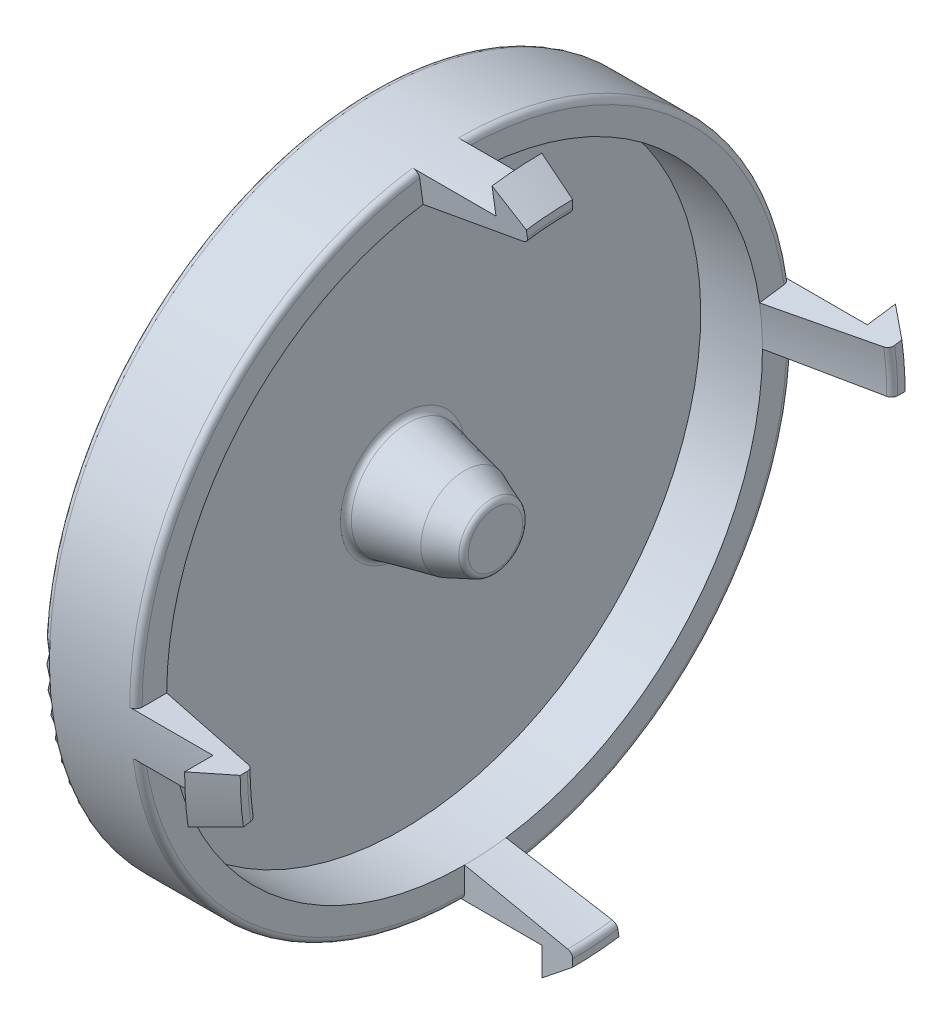
from build123d import *

# Parameters (mm, degrees)
REVOLVE6_ANGLE    = 8
CIRPATTERN2_COUNT = 4
FILLET2_R         = 0.1


with BuildPart() as part:
    # Sketch1 → Revolve2 (revolve)
    with BuildSketch(Plane.XY):
        Polygon((1, 5.325), (0, 5.325), (-0.5, 5.325), (-0.5, 4.885), (-0.5, 1.49), (-0.5, 0), (0.25, 0), (1, 0), (1.5, 0), (1.5, 0.507702176), (1, 0.71), (0, 0.93), (0, 4.825), (1, 4.825), align=None)
    revolve(axis=Axis((1, 0, 0), (-1, 0, 0)))

    # Sketch4 → Revolve6 (revolve)
    with BuildSketch(Plane.XY):
        Polygon((2.75, 5.185), (2.75, 5.385), (2.25, 5.785), (2.25, 5.325), (1, 5.325), (1, 5.185), (1, 4.825), align=None)
    revolve6 = revolve(axis=Axis((0, 0, 0), (1, 0, 0)), revolution_arc=REVOLVE6_ANGLE)

    # CirPattern2: Revolve6 ×4 about axis
    cirpattern2_axis = Axis((0, 0, 0), (-1, 0, 0))
    for i in range(1, CIRPATTERN2_COUNT):
        add(revolve6.rotate(cirpattern2_axis, i * 360 / CIRPATTERN2_COUNT))

    # Fillet2
    # the kernel refuses this fillet: 0.1 mm, written as the material it adds along each edge
    with BuildSketch(Plane(origin=(0, 0, 0), x_dir=(0, 1, 0), z_dir=(0, 0, 1))) as fillet2_piece_1:
        with BuildLine():
            CenterArc((0.93 + FILLET2_R * 0.803914058894, -FILLET2_R), FILLET2_R, 90, 77.592581473)
            Line((0.93 - FILLET2_R * 0.172730407811, -FILLET2_R * 0.785138217325), (0.93, 0))
            Line((0.93, 0), (0.93 + FILLET2_R * 0.803914058894, 0))
        make_face()
    revolve(axis=Axis((0, 0, 0), (-1, 0, 0)))
    # the kernel refuses this fillet: 0.1 mm, written as the material it takes off along each edge
    with BuildSketch(Plane(origin=(1.5, 0, 0), x_dir=(0, 1, 0), z_dir=(0, 0, 1))) as fillet2_2_piece_1:
        with BuildLine():
            CenterArc((0.507702176 - FILLET2_R * 0.674152532906, FILLET2_R), FILLET2_R, 270, 67.971958378)
            Line((0.507702176 - FILLET2_R * 0.674152532906, 0), (0.507702176, 0))
            Line((0.507702176, 0), (0.507702176 + FILLET2_R * 0.252847871179, FILLET2_R * 0.62493967042))
        make_face()
    revolve(axis=Axis((1.5, 0, 0), (-1, 0, 0)), mode=Mode.SUBTRACT)
    with BuildSketch(Plane(origin=(1, 0, 0), x_dir=(0, 1, 0), z_dir=(0, 0, 1))) as fillet2_2_piece_2:
        with BuildLine():
            CenterArc((5.325 - FILLET2_R, FILLET2_R), FILLET2_R, 270, 90)
            Line((5.325, FILLET2_R), (5.325, 0))
            Line((5.325, 0), (5.325 - FILLET2_R, 0))
        make_face()
    revolve(axis=Axis((1, 0, 0), (-1, 0, 0)), revolution_arc=82, mode=Mode.SUBTRACT)
    with BuildSketch(Plane(origin=(2.75, 0, 0), x_dir=(0, -0.03929693023506649, -0.9992275773186509), z_dir=(0, -0.9992275773186509, 0.03929693023506649))) as fillet2_2_piece_3:
        with BuildLine():
            CenterArc((5.185 + FILLET2_R * 0.815225657351, -FILLET2_R), FILLET2_R, 90, 78.375604276)
            Line((5.185 + FILLET2_R * 0.815225657351, 0), (5.185, 0))
            Line((5.185, 0), (5.185 - FILLET2_R * 0.164263887349, -FILLET2_R * 0.798505007947))
        make_face()
    revolve(axis=Axis((2.75, 0, 0), (1, 0, 0)), revolution_arc=12.50425629, mode=Mode.SUBTRACT)
    with BuildSketch(Plane(origin=(1, 0, 0), x_dir=(0, 0, -1), z_dir=(0, 1, 0))) as fillet2_2_piece_4:
        with BuildLine():
            CenterArc((5.325 - FILLET2_R, FILLET2_R), FILLET2_R, 270, 90)
            Line((5.325, FILLET2_R), (5.325, 0))
            Line((5.325, 0), (5.325 - FILLET2_R, 0))
        make_face()
    revolve(axis=Axis((1, 0, 0), (-1, 0, 0)), revolution_arc=82, mode=Mode.SUBTRACT)
    with BuildSketch(Plane(origin=(2.75, 0, 0), x_dir=(0, -0.9992275773186509, 0.039296930235066474), z_dir=(0, 0.039296930235066474, 0.9992275773186509))) as fillet2_2_piece_5:
        with BuildLine():
            CenterArc((5.185 + FILLET2_R * 0.815225657351, -FILLET2_R), FILLET2_R, 90, 78.375604276)
            Line((5.185 + FILLET2_R * 0.815225657351, 0), (5.185, 0))
            Line((5.185, 0), (5.185 - FILLET2_R * 0.164263887349, -FILLET2_R * 0.798505007947))
        make_face()
    revolve(axis=Axis((2.75, 0, 0), (1, 0, 0)), revolution_arc=12.50425629, mode=Mode.SUBTRACT)
    with BuildSketch(Plane(origin=(1, 0, 0), x_dir=(0, -1, 0), z_dir=(0, 0, -1))) as fillet2_2_piece_6:
        with BuildLine():
            CenterArc((5.325 - FILLET2_R, FILLET2_R), FILLET2_R, 270, 90)
            Line((5.325, FILLET2_R), (5.325, 0))
            Line((5.325, 0), (5.325 - FILLET2_R, 0))
        make_face()
    revolve(axis=Axis((1, 0, 0), (-1, 0, 0)), revolution_arc=82, mode=Mode.SUBTRACT)
    with BuildSketch(Plane(origin=(2.75, 0, 0), x_dir=(0, 0.039296930235066384, 0.9992275773186509), z_dir=(0, 0.9992275773186509, -0.039296930235066384))) as fillet2_2_piece_7:
        with BuildLine():
            CenterArc((5.185 + FILLET2_R * 0.815225657351, -FILLET2_R), FILLET2_R, 90, 78.375604276)
            Line((5.185 + FILLET2_R * 0.815225657351, 0), (5.185, 0))
            Line((5.185, 0), (5.185 - FILLET2_R * 0.164263887349, -FILLET2_R * 0.798505007947))
        make_face()
    revolve(axis=Axis((2.75, 0, 0), (1, 0, 0)), revolution_arc=12.50425629, mode=Mode.SUBTRACT)
    with BuildSketch(Plane(origin=(1, 0, 0), x_dir=(0, 0, 1), z_dir=(0, -1, 0))) as fillet2_2_piece_8:
        with BuildLine():
            CenterArc((5.325 - FILLET2_R, FILLET2_R), FILLET2_R, 270, 90)
            Line((5.325, FILLET2_R), (5.325, 0))
            Line((5.325, 0), (5.325 - FILLET2_R, 0))
        make_face()
    revolve(axis=Axis((1, 0, 0), (-1, 0, 0)), revolution_arc=82, mode=Mode.SUBTRACT)
    with BuildSketch(Plane(origin=(2.75, 0, 0), x_dir=(0, 0.9992275773186509, -0.0392969302350666), z_dir=(0, -0.0392969302350666, -0.9992275773186509))) as fillet2_2_piece_9:
        with BuildLine():
            CenterArc((5.185 + FILLET2_R * 0.815225657351, -FILLET2_R), FILLET2_R, 90, 78.375604276)
            Line((5.185 + FILLET2_R * 0.815225657351, 0), (5.185, 0))
            Line((5.185, 0), (5.185 - FILLET2_R * 0.164263887349, -FILLET2_R * 0.798505007947))
        make_face()
    revolve(axis=Axis((2.75, 0, 0), (1, 0, 0)), revolution_arc=12.50425629, mode=Mode.SUBTRACT)
    with BuildSketch(Plane(origin=(-0.5, 0, 0), x_dir=(0, 1, 0), z_dir=(0, 0, 1))) as fillet2_2_piece_10:
        with BuildLine():
            CenterArc((5.325 - FILLET2_R, -FILLET2_R), FILLET2_R, 0, 90)
            Line((5.325 - FILLET2_R, 0), (5.325, 0))
            Line((5.325, 0), (5.325, -FILLET2_R))
        make_face()
    revolve(axis=Axis((-0.5, 0, 0), (-1, 0, 0)), mode=Mode.SUBTRACT)


solid = part.part
